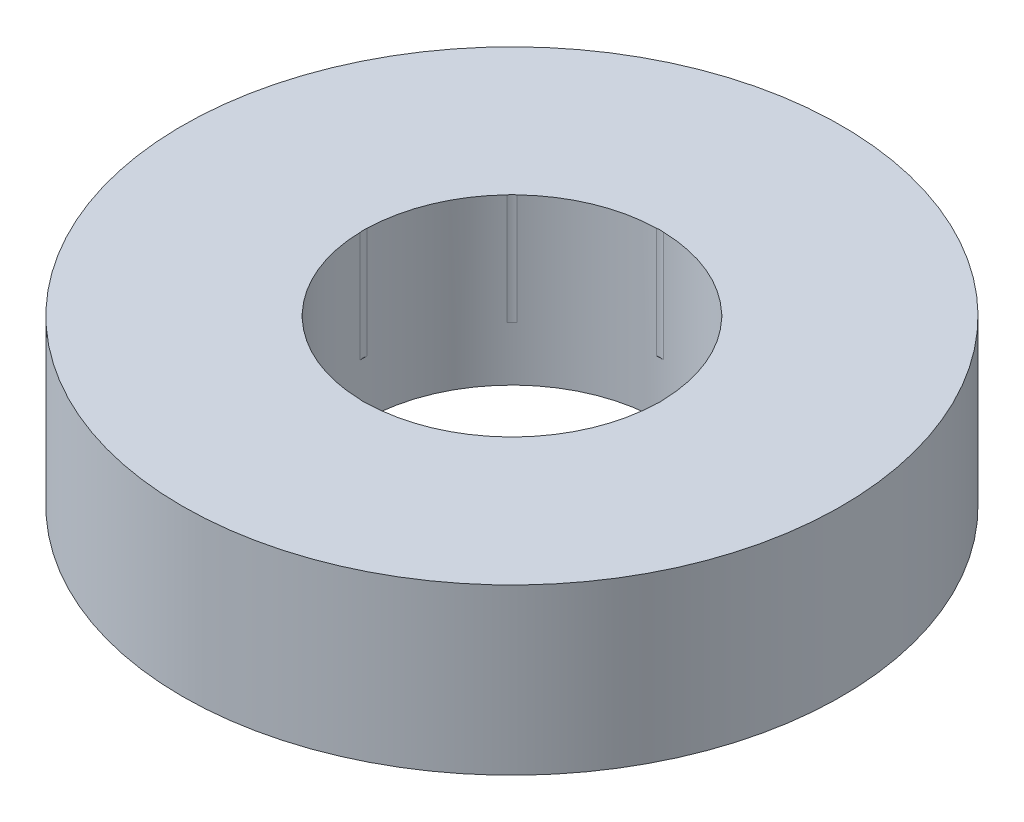
from build123d import *

# Parameters (mm, degrees)
SKETCH1_R           = 50
BOSS_EXTRUDE1_DEPTH = 25
SKETCH2_R           = 22.5
CUT_EXTRUDE1_DEPTH  = 76
SKETCH3_R           = 3.398005305
CUT_EXTRUDE2_DEPTH  = 16.77346942
CIRPATTERN1_COUNT   = 8


with BuildPart() as part:
    # Sketch1 → Boss-Extrude1 (new body)
    with BuildSketch(Plane(origin=(0, 0, 0), x_dir=(1, 0, 0), z_dir=(0, 1, 0))):
        Circle(SKETCH1_R)
    extrude(amount=BOSS_EXTRUDE1_DEPTH)

    # Sketch2 → Cut-Extrude1 (cut, through all)
    with BuildSketch(Plane(origin=(0, 0, 0), x_dir=(1, 0, 0), z_dir=(0, 1, 0))):
        Circle(SKETCH2_R)
    extrude(amount=CUT_EXTRUDE1_DEPTH, mode=Mode.SUBTRACT)

    # Sketch3 → Cut-Extrude2 (cut)
    with BuildSketch(Plane(origin=(0, 25, 0), x_dir=(1, 0, 0), z_dir=(0, 1, 0))):
        with Locations((-19.138537102, 0)):
            Circle(SKETCH3_R)
    cut_extrude2 = extrude(amount=-CUT_EXTRUDE2_DEPTH, mode=Mode.SUBTRACT)

    # CirPattern1: Cut-Extrude2 ×8 about axis
    cirpattern1_axis = Axis((0, 0, 0), (0, 1, 0))
    for i in range(1, CIRPATTERN1_COUNT):
        add(cut_extrude2.rotate(cirpattern1_axis, i * 360 / CIRPATTERN1_COUNT), mode=Mode.SUBTRACT)


solid = part.part
